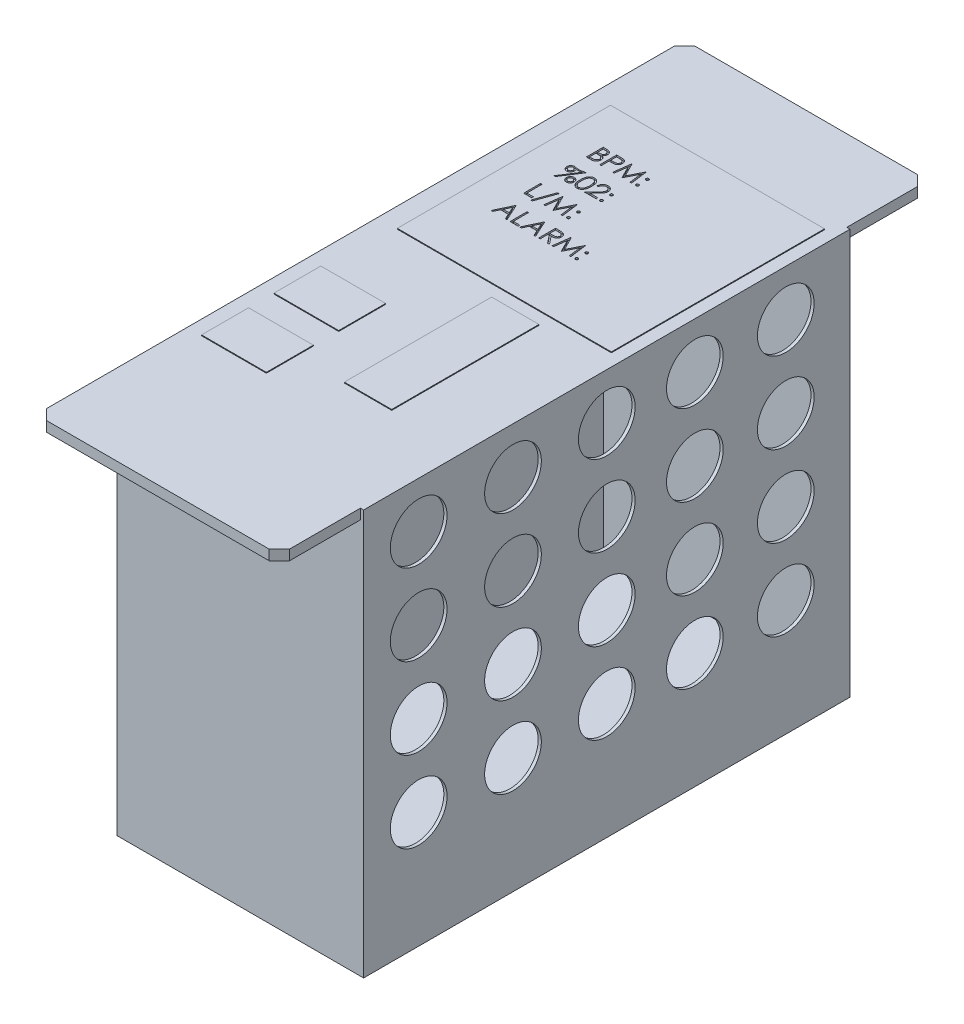
from build123d import *

# Parameters (mm, degrees)
BOSS_EXTRUDE1_DEPTH = 76.2
SHELL1_T            = -2.54
SKETCH2_W           = 152.4
SKETCH2_H           = 127
SKETCH2_R           = 8.89
BOSS_EXTRUDE2_DEPTH = 1
SKETCH3_W           = 67.063290056
SKETCH3_H           = 66.799924184
SKETCH3_W_2         = 20.30243091
SKETCH3_H_2         = 14.698436083
SKETCH3_W_3         = 14.845093403
SKETCH3_H_3         = 46.15113371
SKETCH3_H_4         = 14.721186254
BOSS_EXTRUDE3_DEPTH = 0.254
CHAMFER1_SIZE       = 3.175
CUT_EXTRUDE1_DEPTH  = 0.508


with BuildPart() as part:
    # Sketch1 → Boss-Extrude1 (new body)
    with BuildSketch(Plane(origin=(0, 0, 0), x_dir=(0, 0, -1), z_dir=(1, 0, 0))):
        Polygon((-76.2, 0), (76.2, 0), (76.2, 123.825), (101.6, 123.825), (101.6, 127), (-101.6, 127), (-101.6, 123.825), (-76.2, 123.825), align=None)
    extrude(amount=-BOSS_EXTRUDE1_DEPTH)

    # Shell1
    shell1_openings = [part.faces().sort_by_distance(p)[0] for p in [
        (0, 64.011673554, 0),
    ]]
    offset(amount=SHELL1_T, openings=shell1_openings, kind=Kind.INTERSECTION)

    # Sketch2 → Boss-Extrude2 (add)
    with BuildSketch(Plane(origin=(0, 0, 0), x_dir=(0, 0, -1), z_dir=(1, 0, 0))):
        with Locations((0, 63.5)):
            Rectangle(SKETCH2_W, SKETCH2_H)
        with Locations((-58.940716084, 112.504202573)):
            Circle(SKETCH2_R, mode=Mode.SUBTRACT)
        with Locations((-29.38634328, 112.504202573)):
            Circle(SKETCH2_R, mode=Mode.SUBTRACT)
        with Locations((0, 112.504202573)):
            Circle(SKETCH2_R, mode=Mode.SUBTRACT)
        with Locations((27.59532567, 112.504202573)):
            Circle(SKETCH2_R, mode=Mode.SUBTRACT)
        with Locations((56.090557901, 112.504202573)):
            Circle(SKETCH2_R, mode=Mode.SUBTRACT)
        with Locations((-58.940716084, 87.104202573)):
            Circle(SKETCH2_R, mode=Mode.SUBTRACT)
        with Locations((-29.38634328, 87.104202573)):
            Circle(SKETCH2_R, mode=Mode.SUBTRACT)
        with Locations((0, 87.104202573)):
            Circle(SKETCH2_R, mode=Mode.SUBTRACT)
        with Locations((27.59532567, 87.104202573)):
            Circle(SKETCH2_R, mode=Mode.SUBTRACT)
        with Locations((56.090557901, 87.104202573)):
            Circle(SKETCH2_R, mode=Mode.SUBTRACT)
        with Locations((-58.940716084, 61.704202573)):
            Circle(SKETCH2_R, mode=Mode.SUBTRACT)
        with Locations((-29.38634328, 61.704202573)):
            Circle(SKETCH2_R, mode=Mode.SUBTRACT)
        with Locations((0, 61.704202573)):
            Circle(SKETCH2_R, mode=Mode.SUBTRACT)
        with Locations((27.59532567, 61.704202573)):
            Circle(SKETCH2_R, mode=Mode.SUBTRACT)
        with Locations((56.090557901, 61.704202573)):
            Circle(SKETCH2_R, mode=Mode.SUBTRACT)
        with Locations((-58.940716084, 36.304202573)):
            Circle(SKETCH2_R, mode=Mode.SUBTRACT)
        with Locations((-29.38634328, 36.304202573)):
            Circle(SKETCH2_R, mode=Mode.SUBTRACT)
        with Locations((0, 36.304202573)):
            Circle(SKETCH2_R, mode=Mode.SUBTRACT)
        with Locations((27.59532567, 36.304202573)):
            Circle(SKETCH2_R, mode=Mode.SUBTRACT)
        with Locations((56.090557901, 36.304202573)):
            Circle(SKETCH2_R, mode=Mode.SUBTRACT)
    extrude(amount=BOSS_EXTRUDE2_DEPTH)

    # Sketch3 → Boss-Extrude3 (add)
    with BuildSketch(Plane(origin=(0, 127, 0), x_dir=(1, 0, 0), z_dir=(0, 1, 0))):
        with Locations((-36.369581302, 38.672746326)):
            Rectangle(SKETCH3_W, SKETCH3_H)
        with Locations((-61.498070309, -24.301810751)):
            Rectangle(SKETCH3_W_2, SKETCH3_H_2)
        with Locations((-29.053207457, -21.683721901)):
            Rectangle(SKETCH3_W_3, SKETCH3_H_3)
        with Locations((-61.498070309, -46.957283717)):
            Rectangle(SKETCH3_W_2, SKETCH3_H_4)
    extrude(amount=BOSS_EXTRUDE3_DEPTH)

    # Chamfer1
    chamfer1_edges = [part.edges().sort_by_distance(p)[0] for p in [
        (0, 125.4125, 101.6),
        (-76.2, 125.4125, 101.6),
        (-76.2, 125.4125, -101.6),
        (0, 125.4125, -101.6),
    ]]
    chamfer(chamfer1_edges, length=CHAMFER1_SIZE)

    # Sketch4 → Cut-Extrude1 (cut)
    # profile 1 of 23: a face of its own
    with BuildSketch(Plane(origin=(0, 127.254, 0), x_dir=(1, 0, 0), z_dir=(0, 1, 0))):
        with BuildLine():
            Line((-59.643825401, 59.529582894), (-58.611356784, 59.529582894))
            add(Edge.make_bspline(
                [(-58.611356784, 59.529582894), (-58.560816109, 59.529317176), (-58.462855702, 59.528802149), (-58.320404879, 59.520814558), (-58.186981082, 59.509923295), (-58.062545616, 59.492642083), (-57.947155983, 59.47179023), (-57.840464436, 59.446538675), (-57.742810247, 59.416260342), (-57.626223134, 59.368111798), (-57.493295468, 59.296563674), (-57.349364565, 59.190838344), (-57.226289108, 59.061521405), (-57.12017408, 58.915648819), (-57.035808102, 58.75518164), (-56.974773569, 58.583944533), (-56.936132496, 58.404146186), (-56.932158553, 58.280709476), (-56.930150187, 58.218326551)],
                knots=[0, 0, 0, 0, 1.001505555, 1.941167018, 2.826882275, 3.653841531, 4.429895133, 5.150066043, 5.825578002, 6.45369114, 7.647487171, 8.808567382, 9.977351308, 11.170798116, 12.373658725, 13.556498008, 14.765093433, 16, 16, 16, 16], degree=3))
            add(Edge.make_bspline(
                [(-56.930150187, 58.218326551), (-56.931803029, 58.159887568), (-56.93505102, 58.045049455), (-56.966109716, 57.877085742), (-57.014733583, 57.717199971), (-57.082323662, 57.56597565), (-57.170168347, 57.426829592), (-57.274275567, 57.298639321), (-57.39987978, 57.186832365), (-57.493985631, 57.124325834), (-57.54178714, 57.092575349)],
                knots=[0, 0, 0, 0, 1.044552857, 2.05264487, 3.044412934, 4.028983338, 5.005914585, 5.980388656, 6.974128949, 8, 8, 8, 8], degree=3))
            add(Edge.make_bspline(
                [(-57.54178714, 57.092575349), (-57.48167316, 57.069496124), (-57.366660225, 57.02533985), (-57.208384944, 56.947271946), (-57.072018929, 56.862360184), (-56.95651372, 56.769632268), (-56.857729408, 56.669682042), (-56.771470794, 56.561043953), (-56.697869193, 56.442300831), (-56.634803225, 56.314690724), (-56.585592606, 56.179516658), (-56.54873856, 56.038046556), (-56.527621107, 55.890787705), (-56.524615983, 55.790570524), (-56.523098905, 55.739977859)],
                knots=[0, 0, 0, 0, 1.27268992, 2.434971085, 3.483601985, 4.442670788, 5.356604649, 6.2567628, 7.179492994, 8.113709626, 9.066344395, 10.018646069, 10.999752585, 12, 12, 12, 12], degree=3))
            add(Edge.make_bspline(
                [(-56.523098905, 55.739977859), (-56.524575803, 55.688320803), (-56.527481642, 55.586684096), (-56.548920409, 55.437375738), (-56.585219892, 55.294689807), (-56.635220315, 55.1577034), (-56.700477624, 55.02668153), (-56.779894904, 54.901475762), (-56.874587863, 54.783344095), (-56.980516248, 54.670973856), (-57.100353063, 54.569936606), (-57.229644741, 54.479954525), (-57.370019534, 54.405952741), (-57.519171953, 54.343789232), (-57.678775145, 54.296304539), (-57.848112421, 54.2630841), (-58.027037734, 54.240700294), (-58.149819144, 54.238859996), (-58.212785737, 54.237916227)],
                knots=[0, 0, 0, 0, 0.978564426, 1.925352924, 2.850884081, 3.763762016, 4.682927383, 5.618979971, 6.567305752, 7.547517671, 8.540179244, 9.531824382, 10.526200242, 11.540722885, 12.589160233, 13.674978461, 14.80764778, 16, 16, 16, 16], degree=3))
            Line((-58.212785737, 54.237916227), (-59.643825401, 54.237916227))
            Line((-59.643825401, 54.237916227), (-59.643825401, 59.529582894))
        make_face()
        with BuildLine():
            Line((-59.168932238, 58.986847851), (-59.168932238, 57.290800843))
            Line((-59.168932238, 57.290800843), (-58.849863395, 57.290800843))
            add(Edge.make_bspline(
                [(-58.849863395, 57.290800843), (-58.803222954, 57.291405488), (-58.713104118, 57.292573787), (-58.582596656, 57.295920414), (-58.461455259, 57.305291265), (-58.349889035, 57.314659423), (-58.248073674, 57.32989124), (-58.15623474, 57.348022188), (-58.072930909, 57.367197532), (-57.976865167, 57.399808542), (-57.867897734, 57.448004551), (-57.751733397, 57.522801256), (-57.64932533, 57.611889266), (-57.56284863, 57.714685125), (-57.492074145, 57.827875668), (-57.442916504, 57.94965488), (-57.40958311, 58.076987699), (-57.406572104, 58.16440339), (-57.405043349, 58.208786286)],
                knots=[0, 0, 0, 0, 1.156816544, 2.235205308, 3.236616184, 4.169592532, 5.011045266, 5.787822928, 6.49130361, 7.128639758, 8.301311294, 9.436451833, 10.541879658, 11.654887649, 12.756523258, 13.837046038, 14.901820046, 16, 16, 16, 16], degree=3))
            add(Edge.make_bspline(
                [(-57.405043349, 58.208786286), (-57.405838884, 58.238156203), (-57.407399411, 58.295768501), (-57.42018, 58.379753834), (-57.441902404, 58.458741412), (-57.469803538, 58.533813698), (-57.508793579, 58.602623281), (-57.554700244, 58.667549303), (-57.610165514, 58.72638072), (-57.673298593, 58.781367938), (-57.745883059, 58.830118593), (-57.827875607, 58.872815938), (-57.920385548, 58.907197826), (-58.021853793, 58.937309152), (-58.133842223, 58.95845812), (-58.255058512, 58.976076932), (-58.386495527, 58.985046673), (-58.477429194, 58.986234067), (-58.524434375, 58.986847851)],
                knots=[0, 0, 0, 0, 0.91205012, 1.789085906, 2.630437955, 3.453916878, 4.269457761, 5.079663411, 5.91843418, 6.774407191, 7.675494373, 8.627863946, 9.638891023, 10.736472738, 11.911756761, 13.175263542, 14.539845004, 16, 16, 16, 16], degree=3))
            Line((-58.524434375, 58.986847851), (-59.168932238, 58.986847851))
        make_face(mode=Mode.SUBTRACT)
        with BuildLine():
            Line((-59.168932238, 56.7480658), (-59.168932238, 54.78065127))
            Line((-59.168932238, 54.78065127), (-58.492633494, 54.78065127))
            add(Edge.make_bspline(
                [(-58.492633494, 54.78065127), (-58.444223927, 54.78123146), (-58.35092087, 54.782349698), (-58.216208295, 54.786000275), (-58.091350508, 54.794304073), (-57.976917255, 54.807375774), (-57.87167288, 54.821555096), (-57.776879924, 54.840622152), (-57.691769977, 54.862467604), (-57.59308144, 54.896234745), (-57.481951136, 54.948692505), (-57.362191865, 55.027786633), (-57.25571413, 55.122013539), (-57.165294274, 55.231068611), (-57.091191303, 55.349649308), (-57.037283651, 55.475357158), (-57.00403557, 55.606115039), (-57.000010624, 55.695267093), (-56.997992067, 55.739977859)],
                knots=[0, 0, 0, 0, 1.160039823, 2.235823828, 3.228722157, 4.157150951, 4.99529583, 5.772374946, 6.472645482, 7.099169577, 8.269452708, 9.405989375, 10.527446681, 11.663510218, 12.788923519, 13.866172445, 14.929861265, 16, 16, 16, 16], degree=3))
            add(Edge.make_bspline(
                [(-56.997992067, 55.739977859), (-56.998409511, 55.767938029), (-56.999237664, 55.823407368), (-57.011726927, 55.904922952), (-57.029890754, 55.983883498), (-57.053372803, 56.060503415), (-57.087571283, 56.133397449), (-57.127495464, 56.204007271), (-57.174306155, 56.272426222), (-57.247246739, 56.3589257), (-57.353340097, 56.458585946), (-57.504087245, 56.556160503), (-57.675495362, 56.63485183), (-57.7998155, 56.668264134), (-57.864036071, 56.685524067)],
                knots=[0, 0, 0, 0, 0.723448775, 1.435228256, 2.130040452, 2.821711965, 3.505591119, 4.210454504, 4.921174351, 5.648778258, 7.137944449, 8.670945889, 10.280296675, 12, 12, 12, 12], degree=3))
            add(Edge.make_bspline(
                [(-57.864036071, 56.685524067), (-57.889782442, 56.690747824), (-57.945605885, 56.702074009), (-58.036634013, 56.714029703), (-58.140556101, 56.724681163), (-58.257612117, 56.732559937), (-58.387950163, 56.740703878), (-58.531848599, 56.743871048), (-58.688719777, 56.747649691), (-58.797565388, 56.747923549), (-58.854103512, 56.7480658)],
                knots=[0, 0, 0, 0, 0.634451884, 1.375622551, 2.216452059, 3.157844607, 4.20941857, 5.370758133, 6.634282058, 8, 8, 8, 8], degree=3))
            Line((-58.854103512, 56.7480658), (-59.168932238, 56.7480658))
        make_face(mode=Mode.SUBTRACT)
    # profile 2 of 23: a face of its own
    with BuildSketch(Plane(origin=(0, 127.254, 0), x_dir=(1, 0, 0), z_dir=(0, 1, 0))):
        with BuildLine():
            Line((-55.43762882, 59.529582894), (-54.399860056, 59.529582894))
            add(Edge.make_bspline(
                [(-54.399860056, 59.529582894), (-54.328481662, 59.529504432), (-54.19171749, 59.529354095), (-53.995600679, 59.524796086), (-53.817483585, 59.518708111), (-53.657750271, 59.51026882), (-53.515909266, 59.500295404), (-53.392602396, 59.486307202), (-53.286860448, 59.471701755), (-53.223501887, 59.456852724), (-53.194606651, 59.45008069)],
                knots=[0, 0, 0, 0, 1.415646017, 2.712440637, 3.8905458, 4.950247383, 5.884950622, 6.709939814, 7.411656543, 8, 8, 8, 8], degree=3))
            add(Edge.make_bspline(
                [(-53.194606651, 59.45008069), (-53.158028332, 59.440068933), (-53.085733616, 59.420281333), (-52.981561801, 59.380648679), (-52.88245063, 59.333655406), (-52.788060059, 59.280097782), (-52.699550005, 59.217677941), (-52.61559992, 59.148926162), (-52.536950664, 59.0722551), (-52.464044512, 58.988524696), (-52.397090115, 58.899140569), (-52.339441666, 58.802768388), (-52.29117074, 58.701030346), (-52.249769841, 58.593997209), (-52.219972535, 58.480770172), (-52.197525437, 58.362135976), (-52.183277809, 58.238107337), (-52.181913222, 58.153350156), (-52.181218563, 58.110203554)],
                knots=[0, 0, 0, 0, 0.999701418, 1.975846123, 2.934577507, 3.890451536, 4.834027766, 5.787354733, 6.749476667, 7.726910423, 8.712836071, 9.690891519, 10.682875813, 11.679750201, 12.712814741, 13.765529915, 14.8625177, 16, 16, 16, 16], degree=3))
            add(Edge.make_bspline(
                [(-52.181218563, 58.110203554), (-52.181855717, 58.066694296), (-52.183102352, 57.981565495), (-52.198064593, 57.857025684), (-52.218218573, 57.738010975), (-52.249208164, 57.624785258), (-52.289796265, 57.518020939), (-52.33740925, 57.416086457), (-52.39483673, 57.320716), (-52.460823556, 57.231563335), (-52.534228943, 57.148544777), (-52.614742314, 57.072261933), (-52.702038625, 57.003161326), (-52.795840444, 56.941088044), (-52.897062239, 56.887481526), (-53.004168829, 56.839467506), (-53.11809118, 56.799143402), (-53.196925695, 56.777931286), (-53.237007826, 56.767146329)],
                knots=[0, 0, 0, 0, 1.121902311, 2.195077645, 3.232258892, 4.234102512, 5.217864754, 6.176164875, 7.132989551, 8.084763148, 9.034132444, 9.988522005, 10.94243251, 11.903244335, 12.886203696, 13.894208494, 14.929344452, 16, 16, 16, 16], degree=3))
            add(Edge.make_bspline(
                [(-53.237007826, 56.767146329), (-53.270159867, 56.760096346), (-53.342814491, 56.744645897), (-53.46247075, 56.727397397), (-53.601785798, 56.712675072), (-53.760569483, 56.701636447), (-53.938679279, 56.692186486), (-54.136211538, 56.684675201), (-54.353554011, 56.680547922), (-54.505154583, 56.680335057), (-54.584305168, 56.68022392)],
                knots=[0, 0, 0, 0, 0.601384939, 1.31797006, 2.144135048, 3.087295005, 4.142315834, 5.309527816, 6.595305764, 8, 8, 8, 8], degree=3))
            Line((-54.584305168, 56.68022392), (-54.962735657, 56.68022392))
            Line((-54.962735657, 56.68022392), (-54.962735657, 54.237916227))
            Line((-54.962735657, 54.237916227), (-55.43762882, 54.237916227))
            Line((-55.43762882, 54.237916227), (-55.43762882, 59.529582894))
        make_face()
        with BuildLine():
            Line((-54.962735657, 58.986847851), (-54.962735657, 57.222958962))
            Line((-54.962735657, 57.222958962), (-54.036269979, 57.211298639))
            add(Edge.make_bspline(
                [(-54.036269979, 57.211298639), (-53.9910339, 57.21127526), (-53.903706584, 57.211230126), (-53.777558961, 57.217255404), (-53.660523491, 57.224210972), (-53.552959668, 57.234395046), (-53.454819005, 57.248790281), (-53.365937861, 57.263322313), (-53.287005421, 57.284345897), (-53.194629247, 57.312653395), (-53.09169371, 57.360932468), (-52.97971063, 57.431009088), (-52.884807482, 57.520333492), (-52.80268339, 57.620766046), (-52.737511408, 57.732494492), (-52.689801753, 57.852039194), (-52.661769289, 57.978174157), (-52.658010401, 58.064485986), (-52.656111726, 58.108083495)],
                knots=[0, 0, 0, 0, 1.160613943, 2.240541288, 3.23993089, 4.169200891, 5.011653406, 5.7853311, 6.478053781, 7.106038997, 8.262395093, 9.384106736, 10.481365981, 11.59014053, 12.70357646, 13.786202915, 14.881775077, 16, 16, 16, 16], degree=3))
            add(Edge.make_bspline(
                [(-52.656111726, 58.108083495), (-52.658020727, 58.150626247), (-52.661815585, 58.235195974), (-52.690021473, 58.359140053), (-52.73741865, 58.477424987), (-52.803120882, 58.587753342), (-52.882860448, 58.68782451), (-52.975539217, 58.77475469), (-53.080939029, 58.844637502), (-53.178983378, 58.889742583), (-53.266070885, 58.917282345), (-53.341714444, 58.93655133), (-53.427122963, 58.951935877), (-53.522324249, 58.964393221), (-53.626580415, 58.975057382), (-53.740787153, 58.982293324), (-53.864511828, 58.986528859), (-53.950404, 58.986738946), (-53.994928833, 58.986847851)],
                knots=[0, 0, 0, 0, 1.120700087, 2.227813068, 3.331159281, 4.466773991, 5.599788987, 6.693661531, 7.80175334, 8.91857717, 9.525282508, 10.207424825, 10.974604443, 11.810962634, 12.737642355, 13.736264703, 14.826523623, 16, 16, 16, 16], degree=3))
            Line((-53.994928833, 58.986847851), (-54.962735657, 58.986847851))
        make_face(mode=Mode.SUBTRACT)
    # profile 3 of 23: a face of its own
    with BuildSketch(Plane(origin=(0, 127.254, 0), x_dir=(1, 0, 0), z_dir=(0, 1, 0))):
        Polygon((-51.367115999, 54.237916227), (-50.668556637, 59.529582894), (-50.600714757, 59.529582894), (-48.415994204, 55.187702552), (-46.236573798, 59.529582894), (-46.167671888, 59.529582894), (-45.464872409, 54.237916227), (-45.94188563, 54.237916227), (-46.448579674, 58.045541762), (-48.358752618, 54.237916227), (-48.465815585, 54.237916227), (-50.383408734, 58.054021997), (-50.889042749, 54.237916227), align=None)
    # profile 4 of 23: a face of its own
    with BuildSketch(Plane(origin=(0, 127.254, 0), x_dir=(1, 0, 0), z_dir=(0, 1, 0))):
        with BuildLine():
            add(Edge.make_bspline(
                [(-44.006271982, 58.172745287), (-43.976804637, 58.170994249), (-43.919037353, 58.167561545), (-43.835521052, 58.144011097), (-43.759933888, 58.102193837), (-43.692605375, 58.046460827), (-43.637108678, 57.978885241), (-43.593801146, 57.90390095), (-43.570455847, 57.819685447), (-43.567048147, 57.761583439), (-43.56529976, 57.731773065)],
                knots=[0, 0, 0, 0, 1.020151414, 1.999887582, 2.974338812, 3.990962822, 5.007586832, 5.987933904, 6.967670073, 8, 8, 8, 8], degree=3))
            add(Edge.make_bspline(
                [(-43.56529976, 57.731773065), (-43.567048147, 57.701962691), (-43.570455847, 57.643860683), (-43.593801146, 57.55964518), (-43.637108678, 57.484660889), (-43.692605375, 57.417085303), (-43.759933888, 57.361352293), (-43.835521052, 57.319535032), (-43.919037353, 57.295984585), (-43.976804637, 57.29255188), (-44.006271982, 57.290800843)],
                knots=[0, 0, 0, 0, 1.032329927, 2.012066096, 2.992413168, 4.009037178, 5.025661188, 6.000112418, 6.979848586, 8, 8, 8, 8], degree=3))
            add(Edge.make_bspline(
                [(-44.006271982, 57.290800843), (-44.035759722, 57.292494018), (-44.093227129, 57.295793775), (-44.176441672, 57.320045351), (-44.252484744, 57.360964741), (-44.319801239, 57.417188401), (-44.375749872, 57.484311802), (-44.417140097, 57.560161704), (-44.442503298, 57.643617497), (-44.445638411, 57.701913884), (-44.447244204, 57.731773065)],
                knots=[0, 0, 0, 0, 1.020591893, 1.988988293, 2.974634352, 3.991697318, 5.008760285, 5.983632262, 6.967224335, 8, 8, 8, 8], degree=3))
            add(Edge.make_bspline(
                [(-44.447244204, 57.731773065), (-44.445579867, 57.760919282), (-44.442292153, 57.818494416), (-44.41712821, 57.901246098), (-44.375802348, 57.977182113), (-44.319446968, 58.044146674), (-44.252891499, 58.101723484), (-44.176200605, 58.142075115), (-44.093441678, 58.168103861), (-44.035798392, 58.171173128), (-44.006271982, 58.172745287)],
                knots=[0, 0, 0, 0, 1.010056097, 1.99525427, 2.971718109, 3.990441831, 5.01702829, 6.004283803, 6.977741589, 8, 8, 8, 8], degree=3))
        make_face()
    # profile 5 of 23: a face of its own
    with BuildSketch(Plane(origin=(0, 127.254, 0), x_dir=(1, 0, 0), z_dir=(0, 1, 0))):
        with BuildLine():
            add(Edge.make_bspline(
                [(-44.006271982, 55.052018791), (-43.976804637, 55.050267754), (-43.919037353, 55.046835049), (-43.835521052, 55.023284602), (-43.759933888, 54.981467341), (-43.692605375, 54.925734331), (-43.637108678, 54.858158745), (-43.593801146, 54.783174455), (-43.570455847, 54.698958952), (-43.567048147, 54.640856943), (-43.56529976, 54.611046569)],
                knots=[0, 0, 0, 0, 1.020151414, 1.999887582, 2.974338812, 3.990962822, 5.007586832, 5.987933904, 6.967670073, 8, 8, 8, 8], degree=3))
            add(Edge.make_bspline(
                [(-43.56529976, 54.611046569), (-43.567107394, 54.581952487), (-43.570672023, 54.524579385), (-43.593747633, 54.440999079), (-43.637438732, 54.365967925), (-43.692222591, 54.297475407), (-43.759950532, 54.241624329), (-43.835699752, 54.200162843), (-43.918841297, 54.174926159), (-43.976771929, 54.171711401), (-44.006271982, 54.170074347)],
                knots=[0, 0, 0, 0, 1.009421747, 1.99056486, 2.972319754, 3.999869655, 5.017953583, 5.993804169, 6.978383603, 8, 8, 8, 8], degree=3))
            add(Edge.make_bspline(
                [(-44.006271982, 54.170074347), (-44.035793292, 54.171652167), (-44.093426621, 54.174732484), (-44.176257827, 54.200681012), (-44.252468363, 54.241235529), (-44.320183117, 54.297579547), (-44.375425807, 54.365615478), (-44.417192754, 54.441515813), (-44.44227548, 54.52434013), (-44.445574263, 54.581905363), (-44.447244204, 54.611046569)],
                knots=[0, 0, 0, 0, 1.022052826, 1.995314843, 2.982371812, 4.00089066, 5.028879526, 6.005146991, 6.990147033, 8, 8, 8, 8], degree=3))
            add(Edge.make_bspline(
                [(-44.447244204, 54.611046569), (-44.445638411, 54.64090575), (-44.442503298, 54.699202137), (-44.417140097, 54.78265793), (-44.375749872, 54.858507833), (-44.319801239, 54.925631234), (-44.252484744, 54.981854894), (-44.176441672, 55.022774283), (-44.093227129, 55.047025859), (-44.035759722, 55.050325616), (-44.006271982, 55.052018791)],
                knots=[0, 0, 0, 0, 1.032775665, 2.016367738, 2.991239715, 4.008302682, 5.025365648, 6.011011707, 6.979408107, 8, 8, 8, 8], degree=3))
        make_face()
    # profile 6 of 23: a face of its own
    with BuildSketch(Plane(origin=(0, 127.254, 0), x_dir=(1, 0, 0), z_dir=(0, 1, 0))):
        with BuildLine():
            Line((-55.369786939, 49.913664091), (-59.168932238, 44.079262381))
            Line((-59.168932238, 44.079262381), (-59.640645313, 44.079262381))
            Line((-59.640645313, 44.079262381), (-56.181769445, 49.391069606))
            add(Edge.make_bspline(
                [(-56.181769445, 49.391069606), (-56.235034751, 49.378629899), (-56.344321096, 49.353106904), (-56.513502176, 49.322244326), (-56.691094272, 49.293715015), (-56.877286245, 49.273623231), (-57.072003453, 49.256425695), (-57.275227036, 49.243717931), (-57.487313729, 49.236185191), (-57.631530026, 49.235562599), (-57.705031664, 49.235245287)],
                knots=[0, 0, 0, 0, 0.855189208, 1.754622445, 2.688442312, 3.667131484, 4.682095654, 5.744999071, 6.850710588, 8, 8, 8, 8], degree=3))
            Line((-57.705031664, 49.235245287), (-57.897957011, 49.238425375))
            add(Edge.make_bspline(
                [(-57.897957011, 49.238425375), (-57.864230443, 49.187733538), (-57.798376964, 49.088754186), (-57.727730571, 48.927551183), (-57.684370263, 48.76122034), (-57.679062336, 48.648242969), (-57.676410871, 48.591807453)],
                knots=[0, 0, 0, 0, 1.050167499, 2.050525365, 3.026180155, 4, 4, 4, 4], degree=3))
            add(Edge.make_bspline(
                [(-57.676410871, 48.591807453), (-57.677438283, 48.551831921), (-57.679483102, 48.472270196), (-57.695599657, 48.35471863), (-57.722804984, 48.24041352), (-57.758021263, 48.12875786), (-57.806523466, 48.021144589), (-57.865589594, 47.917117898), (-57.932885245, 47.814646752), (-58.012333975, 47.718326093), (-58.098795068, 47.628310772), (-58.194605451, 47.550455393), (-58.295794309, 47.482861667), (-58.405821252, 47.430095706), (-58.521264399, 47.387042028), (-58.644469015, 47.357816119), (-58.774041837, 47.339356451), (-58.862872688, 47.336916632), (-58.908165011, 47.335672638)],
                knots=[0, 0, 0, 0, 0.977982368, 1.946439705, 2.896504964, 3.850770686, 4.806797443, 5.778452989, 6.776037061, 7.802321955, 8.829516982, 9.824775243, 10.817589304, 11.799766913, 12.803663334, 13.827030361, 14.892064627, 16, 16, 16, 16], degree=3))
            add(Edge.make_bspline(
                [(-58.908165011, 47.335672638), (-58.949918638, 47.336587328), (-59.032369357, 47.338393562), (-59.153494224, 47.35583581), (-59.269756653, 47.384249154), (-59.380372678, 47.425033805), (-59.486205683, 47.475903605), (-59.586491456, 47.539267291), (-59.681798344, 47.613669118), (-59.771504252, 47.697888446), (-59.852512251, 47.790759296), (-59.923936226, 47.889177715), (-59.983483019, 47.993291533), (-60.03395358, 48.101411721), (-60.072163291, 48.215246508), (-60.098035896, 48.334042385), (-60.116137066, 48.456984922), (-60.117850825, 48.540858831), (-60.118718563, 48.583327218)],
                knots=[0, 0, 0, 0, 1.033901007, 2.041640166, 3.024666075, 3.993953674, 4.957094558, 5.928632781, 6.926744369, 7.948567375, 8.972188708, 9.975583979, 10.956073043, 11.939215879, 12.927489814, 13.923526243, 14.948606393, 16, 16, 16, 16], degree=3))
            add(Edge.make_bspline(
                [(-60.118718563, 48.583327218), (-60.117146288, 48.6400203), (-60.114046171, 48.751804296), (-60.081652079, 48.914777883), (-60.032357851, 49.070175016), (-59.961219678, 49.215665607), (-59.874328863, 49.352094302), (-59.766272499, 49.473225688), (-59.644102969, 49.582798093), (-59.505457612, 49.674359897), (-59.35913931, 49.750868717), (-59.207130949, 49.804998068), (-59.053561846, 49.83989995), (-58.950039968, 49.843856933), (-58.898624746, 49.84582221)],
                knots=[0, 0, 0, 0, 1.046745478, 2.063909522, 3.059537565, 4.052827418, 5.049290729, 6.039806234, 7.043861919, 8.074671392, 9.102973742, 10.088501715, 11.050634409, 12, 12, 12, 12], degree=3))
            add(Edge.make_bspline(
                [(-58.898624746, 49.84582221), (-58.873139646, 49.844484389), (-58.814794505, 49.841421603), (-58.716915108, 49.824770847), (-58.597569641, 49.800928491), (-58.511603211, 49.778473871), (-58.46507273, 49.766320007)],
                knots=[0, 0, 0, 0, 0.692955639, 1.586440504, 2.693628627, 4, 4, 4, 4], degree=3))
            add(Edge.make_bspline(
                [(-58.46507273, 49.766320007), (-58.386506446, 49.747190317), (-58.227253296, 49.708414608), (-57.980236733, 49.670155168), (-57.7238898, 49.646157639), (-57.54961632, 49.643595888), (-57.461224907, 49.642296569)],
                knots=[0, 0, 0, 0, 0.956358772, 1.938530612, 2.954423861, 4, 4, 4, 4], degree=3))
            add(Edge.make_bspline(
                [(-57.461224907, 49.642296569), (-57.395837284, 49.642759694), (-57.266739543, 49.643674061), (-57.075901529, 49.655364547), (-56.890491095, 49.67026848), (-56.705105307, 49.694507138), (-56.509520771, 49.729561743), (-56.292646722, 49.778242004), (-56.049385133, 49.839486906), (-55.879172992, 49.888080312), (-55.789558574, 49.913664091)],
                knots=[0, 0, 0, 0, 0.92279556, 1.821917, 2.697917306, 3.547904463, 4.459717683, 5.501612841, 6.684632538, 8, 8, 8, 8], degree=3))
            Line((-55.789558574, 49.913664091), (-55.369786939, 49.913664091))
        make_face()
        with BuildLine():
            add(Edge.make_bspline(
                [(-58.899684776, 49.370929048), (-58.924823693, 49.370512659), (-58.974679837, 49.369686865), (-59.047743287, 49.357194375), (-59.118256927, 49.339041104), (-59.186738135, 49.315257818), (-59.251162814, 49.281598794), (-59.31335719, 49.242470816), (-59.371888644, 49.195028574), (-59.445631089, 49.124164443), (-59.52491882, 49.024384936), (-59.594686548, 48.890022404), (-59.636121072, 48.742990795), (-59.641219833, 48.640832351), (-59.643825401, 48.588627365)],
                knots=[0, 0, 0, 0, 0.7534051, 1.494172318, 2.21673533, 2.937741092, 3.663176203, 4.392551616, 5.139288289, 5.91908518, 7.458951164, 8.938359792, 10.435441294, 12, 12, 12, 12], degree=3))
            add(Edge.make_bspline(
                [(-59.643825401, 48.588627365), (-59.641280981, 48.536398794), (-59.63631848, 48.434534965), (-59.594143173, 48.287845631), (-59.525595763, 48.153081898), (-59.429839484, 48.034927621), (-59.317343318, 47.934552706), (-59.18764004, 47.863840033), (-59.047679835, 47.817425264), (-58.949523363, 47.812875782), (-58.899684776, 47.8105658)],
                knots=[0, 0, 0, 0, 1.04580407, 2.039680683, 3.034870211, 4.058616052, 5.073270728, 6.037602874, 7.003600085, 8, 8, 8, 8], degree=3))
            add(Edge.make_bspline(
                [(-58.899684776, 47.8105658), (-58.849490478, 47.812846642), (-58.750975645, 47.817323181), (-58.610643201, 47.863802576), (-58.48082956, 47.934825074), (-58.367525791, 48.034886779), (-58.270419401, 48.152727952), (-58.202403621, 48.288067675), (-58.158457607, 48.434329778), (-58.153727162, 48.536362169), (-58.151304033, 48.588627365)],
                knots=[0, 0, 0, 0, 1.00110557, 1.96483968, 2.926912627, 3.944533771, 4.970300809, 5.963158846, 6.956645999, 8, 8, 8, 8], degree=3))
            add(Edge.make_bspline(
                [(-58.151304033, 48.588627365), (-58.153786932, 48.640870827), (-58.158650228, 48.743200993), (-58.201880278, 48.889776967), (-58.271006634, 49.024834304), (-58.351677965, 49.123804735), (-58.425388674, 49.1954255), (-58.484873121, 49.242129663), (-58.547105899, 49.281649572), (-58.611582209, 49.315244383), (-58.680049741, 49.33904453), (-58.750566861, 49.357194075), (-58.823979263, 49.369744138), (-58.874191216, 49.370530034), (-58.899684776, 49.370929048)],
                knots=[0, 0, 0, 0, 1.560867277, 3.05729751, 4.533215612, 6.076024656, 6.85398169, 7.607244631, 8.334899151, 9.058622666, 9.777927282, 10.498785474, 11.237804921, 12, 12, 12, 12], degree=3))
        make_face(mode=Mode.SUBTRACT)
    # profile 7 of 23: a face of its own
    with BuildSketch(Plane(origin=(0, 127.254, 0), x_dir=(1, 0, 0), z_dir=(0, 1, 0))):
        with BuildLine():
            add(Edge.make_bspline(
                [(-55.980363862, 46.792937595), (-55.93894147, 46.792172461), (-55.857449275, 46.790667178), (-55.737640147, 46.771130035), (-55.621969379, 46.743345332), (-55.511068857, 46.702703077), (-55.405256478, 46.650281611), (-55.304494671, 46.586081057), (-55.207009618, 46.511575975), (-55.116319884, 46.425428724), (-55.033188238, 46.331661245), (-54.959023504, 46.232984268), (-54.897930811, 46.128355597), (-54.845708738, 46.020071975), (-54.8086282, 45.905590601), (-54.779148486, 45.787491039), (-54.76199123, 45.664157335), (-54.760144887, 45.580315139), (-54.759210016, 45.537862809)],
                knots=[0, 0, 0, 0, 1.020349682, 2.007381285, 2.985799444, 3.950543688, 4.913003205, 5.892003121, 6.892328163, 7.933994568, 8.970876379, 9.979853573, 10.972063258, 11.954276001, 12.937917586, 13.933259326, 14.953534604, 16, 16, 16, 16], degree=3))
            add(Edge.make_bspline(
                [(-54.759210016, 45.537862809), (-54.760144809, 45.495410424), (-54.761990998, 45.411568121), (-54.779149379, 45.288235197), (-54.808624954, 45.170132767), (-54.845720699, 45.055661929), (-54.897886031, 44.947338994), (-54.959337807, 44.842613785), (-55.032885192, 44.743161335), (-55.115941919, 44.649149919), (-55.207779492, 44.564377664), (-55.303758335, 44.488246267), (-55.405650458, 44.42570054), (-55.511008596, 44.372931731), (-55.621985785, 44.332405009), (-55.737635708, 44.304588892), (-55.857450433, 44.285060184), (-55.93894186, 44.283553744), (-55.980363862, 44.282788022)],
                knots=[0, 0, 0, 0, 1.046349956, 2.066512682, 3.061744622, 4.045277697, 5.027382088, 6.019482318, 7.035358079, 8.072125507, 9.107720949, 10.113271166, 11.08753877, 12.049892114, 13.014529933, 13.992840158, 14.979762877, 16, 16, 16, 16], degree=3))
            add(Edge.make_bspline(
                [(-55.980363862, 44.282788022), (-56.021787588, 44.283549367), (-56.103282407, 44.285047195), (-56.223072403, 44.304638694), (-56.33849135, 44.332143964), (-56.44913341, 44.373466523), (-56.554890198, 44.425356216), (-56.656945633, 44.488295993), (-56.752956994, 44.564362795), (-56.844775334, 44.649157506), (-56.927875209, 44.743146231), (-57.001273447, 44.842665022), (-57.063186889, 44.947025757), (-57.113379474, 45.056173009), (-57.152508922, 45.169863231), (-57.181459076, 45.28827885), (-57.198767754, 45.411556766), (-57.200593345, 45.495406607), (-57.201517708, 45.537862809)],
                knots=[0, 0, 0, 0, 1.02031541, 2.007313861, 2.985699156, 3.942232143, 4.912475611, 5.886817974, 6.892445352, 7.92812026, 8.964967244, 9.980920958, 10.973097316, 11.951598987, 12.938020436, 13.933328745, 14.953569753, 16, 16, 16, 16], degree=3))
            add(Edge.make_bspline(
                [(-57.201517708, 45.537862809), (-57.200593267, 45.580318956), (-57.198767522, 45.664168691), (-57.181459967, 45.787447386), (-57.152505679, 45.905860138), (-57.113391428, 46.019560897), (-57.063142397, 46.128669008), (-57.001588666, 46.232933439), (-56.927572051, 46.331676287), (-56.844397326, 46.425421129), (-56.753726825, 46.511590806), (-56.65620961, 46.586031864), (-56.555286775, 46.650630144), (-56.449073557, 46.702168927), (-56.338507686, 46.743606262), (-56.223067967, 46.77108024), (-56.103283564, 46.790680165), (-56.021787978, 46.792176838), (-55.980363862, 46.792937595)],
                knots=[0, 0, 0, 0, 1.046545705, 2.066899282, 3.062317408, 4.048847694, 5.027457327, 6.019743158, 7.028797784, 8.065759168, 9.107505514, 10.107907324, 11.086982371, 12.05733289, 13.013971417, 13.992464662, 14.979572013, 16, 16, 16, 16], degree=3))
        make_face()
        with BuildLine():
            add(Edge.make_bspline(
                [(-55.982483921, 46.318044432), (-56.032308665, 46.315709785), (-56.130437873, 46.311111726), (-56.27076322, 46.264998167), (-56.399830838, 46.192791135), (-56.512694268, 46.092712931), (-56.608360598, 45.974439508), (-56.677178225, 45.839426), (-56.71897863, 45.692262415), (-56.724038733, 45.590080029), (-56.726624546, 45.537862809)],
                knots=[0, 0, 0, 0, 0.995121133, 1.959878581, 2.926425669, 3.939778136, 4.962210099, 5.956122399, 6.955538117, 8, 8, 8, 8], degree=3))
            add(Edge.make_bspline(
                [(-56.726624546, 45.537862809), (-56.724038733, 45.485645588), (-56.71897863, 45.383463202), (-56.677178225, 45.236299617), (-56.608360598, 45.101286109), (-56.512694268, 44.983012687), (-56.399830838, 44.882934482), (-56.27076322, 44.81072745), (-56.130437873, 44.764613891), (-56.032308665, 44.760015832), (-55.982483921, 44.757681185)],
                knots=[0, 0, 0, 0, 1.044461883, 2.043877601, 3.037789901, 4.060221864, 5.073574331, 6.040121419, 7.004878867, 8, 8, 8, 8], degree=3))
            add(Edge.make_bspline(
                [(-55.982483921, 44.757681185), (-55.932303601, 44.759986929), (-55.8338162, 44.764512343), (-55.693118413, 44.810690209), (-55.56394175, 44.883209192), (-55.450268728, 44.982971163), (-55.353253808, 45.10093267), (-55.28496559, 45.236520041), (-55.241397624, 45.383259945), (-55.236568587, 45.485609465), (-55.234103179, 45.537862809)],
                knots=[0, 0, 0, 0, 0.999825402, 1.962327134, 2.926614321, 3.942934178, 4.967389512, 5.958977928, 6.957980192, 8, 8, 8, 8], degree=3))
            add(Edge.make_bspline(
                [(-55.234103179, 45.537862809), (-55.236568587, 45.590116152), (-55.241397624, 45.692465672), (-55.28496559, 45.839205576), (-55.353253808, 45.974792947), (-55.450268728, 46.092754454), (-55.56394175, 46.192516425), (-55.693118413, 46.265035408), (-55.8338162, 46.311213275), (-55.932303601, 46.315738689), (-55.982483921, 46.318044432)],
                knots=[0, 0, 0, 0, 1.042019808, 2.041022072, 3.032610488, 4.057065822, 5.073385679, 6.037672866, 7.000174598, 8, 8, 8, 8], degree=3))
        make_face(mode=Mode.SUBTRACT)
    # profile 8 of 23: a face of its own
    with BuildSketch(Plane(origin=(0, 127.254, 0), x_dir=(1, 0, 0), z_dir=(0, 1, 0))):
        with BuildLine():
            add(Edge.make_bspline(
                [(-54.420000614, 47.062185057), (-54.419504682, 47.146998965), (-54.418541327, 47.311751203), (-54.407824309, 47.55181846), (-54.390021113, 47.77703223), (-54.365622942, 47.987403294), (-54.335932187, 48.182985962), (-54.296296868, 48.363257559), (-54.251222749, 48.52905244), (-54.198982742, 48.680911252), (-54.140036918, 48.820879922), (-54.075880357, 48.951546595), (-54.003966918, 49.072713564), (-53.928406585, 49.186314747), (-53.846140715, 49.290490572), (-53.759510401, 49.386712216), (-53.665134469, 49.472755851), (-53.566221111, 49.551142522), (-53.46187479, 49.619857795), (-53.355069807, 49.680383483), (-53.245071016, 49.732090425), (-53.131578096, 49.772746203), (-53.015611134, 49.806326888), (-52.896764735, 49.829291131), (-52.774842673, 49.843740266), (-52.692547528, 49.845121645), (-52.650811579, 49.84582221)],
                knots=[0, 0, 0, 0, 1.646270934, 3.197905019, 4.663502075, 6.030701355, 7.308322542, 8.50163776, 9.611534131, 10.641858119, 11.616356847, 12.558055219, 13.465016945, 14.349605745, 15.204443733, 16.039544428, 16.859896111, 17.680448484, 18.487036065, 19.28249412, 20.06191084, 20.843045899, 21.620316918, 22.403196591, 23.190181807, 24, 24, 24, 24], degree=3))
            add(Edge.make_bspline(
                [(-52.650811579, 49.84582221), (-52.608726986, 49.84508468), (-52.525033973, 49.843617965), (-52.40129912, 49.829521052), (-52.280422815, 49.806130187), (-52.162920391, 49.772987761), (-52.047826662, 49.731870488), (-51.936041855, 49.680334013), (-51.826871624, 49.620343345), (-51.722050832, 49.549852483), (-51.620428735, 49.471260232), (-51.524501458, 49.382416673), (-51.434260269, 49.284218883), (-51.348572605, 49.177717494), (-51.269869499, 49.060869806), (-51.194919191, 48.935708116), (-51.127832899, 48.800043595), (-51.06322214, 48.656139792), (-51.007452529, 48.500014974), (-50.957157134, 48.332549206), (-50.916518694, 48.151764423), (-50.882668246, 47.958609147), (-50.856444415, 47.752374024), (-50.837345064, 47.533501142), (-50.827255995, 47.301846504), (-50.825355982, 47.143462613), (-50.824380956, 47.062185057)],
                knots=[0, 0, 0, 0, 0.810914788, 1.612654377, 2.396697861, 3.181598691, 3.963628158, 4.749916497, 5.551656086, 6.361998678, 7.18212741, 8.025565596, 8.878627764, 9.750805457, 10.657531673, 11.591944965, 12.560506719, 13.57287815, 14.630710178, 15.753379473, 16.941251878, 18.199788006, 19.531962791, 20.947069417, 22.433333509, 24, 24, 24, 24], degree=3))
            add(Edge.make_bspline(
                [(-50.824380956, 47.062185057), (-50.82536609, 46.981262006), (-50.827285583, 46.823586741), (-50.837231961, 46.592974433), (-50.856824177, 46.375263106), (-50.881332136, 46.169930621), (-50.915275854, 45.977831602), (-50.957012236, 45.798301305), (-51.003352605, 45.630564434), (-51.06055521, 45.475995136), (-51.123164261, 45.332437174), (-51.191283426, 45.19838089), (-51.264262806, 45.072641376), (-51.34377198, 44.956225092), (-51.428519402, 44.848307361), (-51.520318916, 44.750793098), (-51.616582777, 44.661332677), (-51.71850393, 44.581728431), (-51.824959489, 44.512052595), (-51.93375476, 44.449741179), (-52.046820114, 44.399496509), (-52.161593269, 44.356354244), (-52.279715917, 44.323394037), (-52.401040818, 44.300603803), (-52.524950841, 44.284620175), (-52.608712731, 44.283400855), (-52.650811579, 44.282788022)],
                knots=[0, 0, 0, 0, 1.561518951, 3.042555995, 4.452378317, 5.7783523, 7.031515105, 8.214008947, 9.334062868, 10.386615937, 11.391082383, 12.354592575, 13.286541444, 14.194233754, 15.072674879, 15.931287219, 16.775624067, 17.606195743, 18.42308326, 19.229000347, 20.022332153, 20.807536673, 21.593273796, 22.3848459, 23.188221202, 24, 24, 24, 24], degree=3))
            add(Edge.make_bspline(
                [(-52.650811579, 44.282788022), (-52.69254637, 44.283493107), (-52.774839232, 44.284883397), (-52.896778019, 44.299267253), (-53.015133618, 44.322392597), (-53.130490067, 44.354772463), (-53.243439203, 44.394406799), (-53.352441922, 44.446043916), (-53.458710206, 44.505513282), (-53.561960535, 44.573239693), (-53.66025273, 44.65083319), (-53.754139907, 44.736655388), (-53.841263448, 44.832847927), (-53.922353093, 44.93789193), (-53.999421059, 45.050820999), (-54.070313326, 45.173176991), (-54.135885927, 45.304474747), (-54.195823109, 45.445562541), (-54.248964541, 45.598499158), (-54.295905719, 45.765034226), (-54.33296879, 45.946637628), (-54.36469302, 46.14185079), (-54.390281076, 46.351512566), (-54.407750115, 46.575736778), (-54.418547103, 46.814383701), (-54.419507269, 46.978077288), (-54.420000614, 47.062185057)],
                knots=[0, 0, 0, 0, 0.810891512, 1.598919785, 2.382837074, 3.152667961, 3.926044502, 4.706494248, 5.493654104, 6.291793342, 7.103789334, 7.925228297, 8.761435821, 9.622817696, 10.50288917, 11.416980706, 12.369136599, 13.353924996, 14.394355917, 15.514179734, 16.714354668, 17.994756427, 19.357759367, 20.818452758, 22.365282078, 24, 24, 24, 24], degree=3))
        make_face()
        with BuildLine():
            add(Edge.make_bspline(
                [(-53.945107452, 47.064305116), (-53.944926859, 46.993625536), (-53.944576365, 46.856450349), (-53.935419966, 46.657115895), (-53.922946401, 46.471196469), (-53.906857773, 46.298456003), (-53.88296522, 46.139479199), (-53.856194243, 45.993172654), (-53.823615584, 45.860310641), (-53.785069545, 45.739981451), (-53.741165196, 45.630142978), (-53.69322895, 45.527936379), (-53.641732381, 45.432154285), (-53.584099856, 45.343657044), (-53.521333034, 45.262156058), (-53.454849654, 45.186208799), (-53.382168485, 45.11848003), (-53.28162116, 45.037250142), (-53.148881252, 44.953310499), (-52.981633659, 44.880215816), (-52.809777787, 44.834280435), (-52.693132444, 44.828438804), (-52.634911138, 44.825523065)],
                knots=[0, 0, 0, 0, 1.459021318, 2.831673884, 4.118529203, 5.306027144, 6.411944654, 7.436330062, 8.375795394, 9.233974572, 10.042671642, 10.816086306, 11.563610507, 12.285937304, 12.993564865, 13.685989202, 14.367179055, 15.041617293, 16.353048772, 17.594441528, 18.799311195, 20, 20, 20, 20], degree=3))
            add(Edge.make_bspline(
                [(-52.634911138, 44.825523065), (-52.57631323, 44.827938757), (-52.459238396, 44.832765155), (-52.288190872, 44.879329912), (-52.122137964, 44.94958743), (-51.992005387, 45.032662826), (-51.893002018, 45.111778276), (-51.822067997, 45.179231375), (-51.756962281, 45.254759889), (-51.695212954, 45.336250491), (-51.638578399, 45.42526008), (-51.587078179, 45.52136064), (-51.540083118, 45.62481904), (-51.513308727, 45.697042336), (-51.499619672, 45.733968244)],
                knots=[0, 0, 0, 0, 1.353760809, 2.704726607, 4.075137775, 5.516104923, 6.260822281, 7.007110065, 7.778089737, 8.566572457, 9.372053459, 10.217411131, 11.088608312, 12, 12, 12, 12], degree=3))
            add(Edge.make_bspline(
                [(-51.499619672, 45.733968244), (-51.483666404, 45.781184636), (-51.451274428, 45.87705416), (-51.409528055, 46.025770634), (-51.376651082, 46.181803384), (-51.347073136, 46.34421993), (-51.326884588, 46.514218049), (-51.310634918, 46.691271749), (-51.301063522, 46.875514523), (-51.299877053, 47.000692664), (-51.299274119, 47.064305116)],
                knots=[0, 0, 0, 0, 0.884706709, 1.796334032, 2.740027952, 3.714592787, 4.726048262, 5.777819803, 6.87074269, 8, 8, 8, 8], degree=3))
            add(Edge.make_bspline(
                [(-51.299274119, 47.064305116), (-51.300105952, 47.127907279), (-51.301733197, 47.252326707), (-51.307953155, 47.434538718), (-51.324014987, 47.607603071), (-51.341854131, 47.772265333), (-51.368157073, 47.927614005), (-51.39651709, 48.074949586), (-51.434618923, 48.212446778), (-51.475319059, 48.342258289), (-51.521901443, 48.462909278), (-51.573178803, 48.574962265), (-51.627942653, 48.678958218), (-51.687424373, 48.774611808), (-51.750917847, 48.862351486), (-51.820098903, 48.940418075), (-51.892223372, 49.01123111), (-51.993244593, 49.092061423), (-52.125497388, 49.174477915), (-52.290061641, 49.250323766), (-52.461316067, 49.293879161), (-52.577087837, 49.300020045), (-52.634911138, 49.303087168)],
                knots=[0, 0, 0, 0, 1.31362396, 2.569729283, 3.763502607, 4.902122613, 5.988968491, 7.01645872, 7.998833611, 8.933434873, 9.825090667, 10.667526885, 11.477055099, 12.250526234, 12.991942729, 13.710640831, 14.402115721, 15.076753259, 16.378508321, 17.609869233, 18.806226677, 20, 20, 20, 20], degree=3))
            add(Edge.make_bspline(
                [(-52.634911138, 49.303087168), (-52.693437866, 49.300015814), (-52.810597945, 49.293867511), (-52.983632353, 49.250486044), (-53.149494885, 49.174871203), (-53.281397953, 49.091788449), (-53.382489631, 49.012657907), (-53.453674179, 48.944037911), (-53.520418987, 48.868977502), (-53.581904676, 48.786726988), (-53.639492045, 48.698332921), (-53.692380005, 48.603099908), (-53.740031205, 48.500545345), (-53.784004254, 48.39075621), (-53.822667874, 48.270437402), (-53.854559938, 48.137739042), (-53.884022506, 47.991897849), (-53.904879639, 47.832060021), (-53.923421269, 47.659276289), (-53.935337117, 47.472892725), (-53.944606994, 47.273223959), (-53.944937292, 47.135339517), (-53.945107452, 47.064305116)],
                knots=[0, 0, 0, 0, 1.207732386, 2.417664972, 3.655092373, 4.956220595, 5.625982001, 6.301752483, 6.994047911, 7.697131622, 8.419323945, 9.170223765, 9.943494443, 10.752040957, 11.610060368, 12.549350801, 13.567764191, 14.679664412, 15.874934091, 17.154273443, 18.533957287, 20, 20, 20, 20], degree=3))
        make_face(mode=Mode.SUBTRACT)
    # profile 9 of 23: a face of its own
    with BuildSketch(Plane(origin=(0, 127.254, 0), x_dir=(1, 0, 0), z_dir=(0, 1, 0))):
        with BuildLine():
            Line((-49.67106899, 48.081933321), (-50.145962153, 48.081933321))
            add(Edge.make_bspline(
                [(-50.145962153, 48.081933321), (-50.142867053, 48.144935735), (-50.136788358, 48.268670799), (-50.108321778, 48.449077181), (-50.067589737, 48.621517174), (-50.009999086, 48.784606211), (-49.9384765, 48.939786312), (-49.852706101, 49.086441098), (-49.751115399, 49.224011109), (-49.635898074, 49.351221027), (-49.510759775, 49.467921283), (-49.3757377, 49.568697662), (-49.233852956, 49.653844618), (-49.085536008, 49.725026971), (-48.929113489, 49.778457453), (-48.766004883, 49.818102075), (-48.595493569, 49.841954407), (-48.479318774, 49.844518273), (-48.420234322, 49.84582221)],
                knots=[0, 0, 0, 0, 1.10065271, 2.161652631, 3.183658789, 4.190468796, 5.17591951, 6.163126047, 7.15150782, 8.156236427, 9.156009102, 10.134482811, 11.092018607, 12.041330605, 13.001268258, 13.972401359, 14.968799086, 16, 16, 16, 16], degree=3))
            add(Edge.make_bspline(
                [(-48.420234322, 49.84582221), (-48.362210329, 49.84446383), (-48.248195255, 49.84179466), (-48.081791971, 49.818872628), (-47.923378681, 49.782971555), (-47.773265034, 49.732601818), (-47.632648722, 49.664892029), (-47.500473405, 49.583555274), (-47.375165512, 49.489484815), (-47.262367161, 49.378732026), (-47.15878947, 49.260497468), (-47.069432489, 49.134271709), (-46.992910206, 49.003901242), (-46.929126452, 48.868391937), (-46.882172527, 48.726467882), (-46.846524522, 48.580195325), (-46.826374742, 48.428060194), (-46.823282257, 48.325089569), (-46.821710016, 48.27273861)],
                knots=[0, 0, 0, 0, 1.111607364, 2.184268762, 3.212621178, 4.221274766, 5.211760367, 6.196651075, 7.1921475, 8.207485113, 9.220403448, 10.201281604, 11.166441695, 12.114753415, 13.065576456, 14.026450734, 14.996634279, 16, 16, 16, 16], degree=3))
            add(Edge.make_bspline(
                [(-46.821710016, 48.27273861), (-46.824270068, 48.199036527), (-46.829345247, 48.052925727), (-46.87275865, 47.83821278), (-46.940562304, 47.630184635), (-47.022201165, 47.46276038), (-47.104558312, 47.327847836), (-47.178773949, 47.216770151), (-47.26565527, 47.097170217), (-47.366466809, 46.969448528), (-47.479123175, 46.83260466), (-47.604644779, 46.686721279), (-47.74392671, 46.533305627), (-47.841684205, 46.428522158), (-47.89233969, 46.37422599)],
                knots=[0, 0, 0, 0, 1.184426356, 2.348067706, 3.509069118, 4.696110526, 5.333549288, 6.050745305, 6.844228056, 7.710549037, 8.667450064, 9.695053472, 10.805634456, 12, 12, 12, 12], degree=3))
            Line((-47.89233969, 46.37422599), (-49.216316386, 44.961206826))
            Line((-49.216316386, 44.961206826), (-46.753868136, 44.961206826))
            Line((-46.753868136, 44.961206826), (-46.753868136, 44.418471783))
            Line((-46.753868136, 44.418471783), (-50.349487794, 44.418471783))
            Line((-50.349487794, 44.418471783), (-48.297270914, 46.608492483))
            add(Edge.make_bspline(
                [(-48.297270914, 46.608492483), (-48.247305656, 46.660650637), (-48.151332622, 46.760835776), (-48.015589917, 46.907101918), (-47.893671446, 47.042794676), (-47.784788007, 47.167657672), (-47.691301636, 47.283517304), (-47.608340047, 47.386621201), (-47.541868261, 47.481499954), (-47.469727127, 47.591476834), (-47.399855989, 47.725752599), (-47.339814688, 47.889845201), (-47.303204144, 48.058766166), (-47.298812309, 48.172918056), (-47.296603179, 48.230337435)],
                knots=[0, 0, 0, 0, 1.329631726, 2.553950428, 3.673215718, 4.687767853, 5.603093632, 6.413772471, 7.123043292, 7.734684054, 8.834405432, 9.900288307, 10.943827018, 12, 12, 12, 12], degree=3))
            add(Edge.make_bspline(
                [(-47.296603179, 48.230337435), (-47.29756436, 48.266443835), (-47.299458665, 48.337602615), (-47.316176851, 48.441932751), (-47.341441544, 48.54257241), (-47.377644494, 48.639831156), (-47.425430875, 48.73273113), (-47.483598961, 48.821385415), (-47.550712509, 48.907093732), (-47.628350738, 48.987456456), (-47.713639583, 49.061057802), (-47.803740413, 49.126257313), (-47.899066166, 49.180745016), (-47.999214922, 49.22541197), (-48.103907477, 49.260450939), (-48.213346318, 49.284729982), (-48.327229057, 49.299973737), (-48.404991604, 49.302036235), (-48.444614997, 49.303087168)],
                knots=[0, 0, 0, 0, 0.991446411, 1.95395049, 2.89581595, 3.838931463, 4.798493298, 5.75982156, 6.748411868, 7.785213223, 8.824556874, 9.840280684, 10.836137867, 11.835679398, 12.848801643, 13.863922112, 14.911575587, 16, 16, 16, 16], degree=3))
            add(Edge.make_bspline(
                [(-48.444614997, 49.303087168), (-48.48599709, 49.302006107), (-48.567264686, 49.299883082), (-48.686582748, 49.28503215), (-48.800407674, 49.259411653), (-48.909025789, 49.224370729), (-49.012620877, 49.179832208), (-49.110689134, 49.124357785), (-49.203010407, 49.058161313), (-49.289758246, 48.983109519), (-49.369683548, 48.89955017), (-49.4399068, 48.806401773), (-49.501265965, 48.705365086), (-49.554801353, 48.59671273), (-49.598277218, 48.4794588), (-49.631498529, 48.354019532), (-49.657785785, 48.220939587), (-49.666567715, 48.129038327), (-49.67106899, 48.081933321)],
                knots=[0, 0, 0, 0, 1.031018746, 2.02475058, 2.990194455, 3.934040569, 4.864654155, 5.795059489, 6.735614925, 7.690564532, 8.649604399, 9.611025574, 10.590972636, 11.591080095, 12.624614302, 13.701020113, 14.821632451, 16, 16, 16, 16], degree=3))
        make_face()
    # profile 10 of 23: a face of its own
    with BuildSketch(Plane(origin=(0, 127.254, 0), x_dir=(1, 0, 0), z_dir=(0, 1, 0))):
        with BuildLine():
            add(Edge.make_bspline(
                [(-45.430951469, 48.353300843), (-45.401484125, 48.351549805), (-45.34371684, 48.3481171), (-45.260200539, 48.324566653), (-45.184613375, 48.282749393), (-45.117284862, 48.227016382), (-45.061788166, 48.159440796), (-45.018480633, 48.084456506), (-44.995135334, 48.000241003), (-44.991727634, 47.942138994), (-44.989979247, 47.912328621)],
                knots=[0, 0, 0, 0, 1.020151414, 1.999887582, 2.974338812, 3.990962822, 5.007586832, 5.987933904, 6.967670073, 8, 8, 8, 8], degree=3))
            add(Edge.make_bspline(
                [(-44.989979247, 47.912328621), (-44.991727634, 47.882518247), (-44.995135334, 47.824416238), (-45.018480633, 47.740200735), (-45.061788166, 47.665216445), (-45.117284862, 47.597640859), (-45.184613375, 47.541907848), (-45.260200539, 47.500090588), (-45.34371684, 47.476540141), (-45.401484125, 47.473107436), (-45.430951469, 47.471356398)],
                knots=[0, 0, 0, 0, 1.032329927, 2.012066096, 2.992413168, 4.009037178, 5.025661188, 6.000112418, 6.979848586, 8, 8, 8, 8], degree=3))
            add(Edge.make_bspline(
                [(-45.430951469, 47.471356398), (-45.460439209, 47.473049574), (-45.517906616, 47.476349331), (-45.601121159, 47.500600907), (-45.677164231, 47.541520296), (-45.744480726, 47.597743956), (-45.800429359, 47.664867357), (-45.841819584, 47.740717259), (-45.867182785, 47.824173053), (-45.870317898, 47.882469439), (-45.871923691, 47.912328621)],
                knots=[0, 0, 0, 0, 1.020591893, 1.988988293, 2.974634352, 3.991697318, 5.008760285, 5.983632262, 6.967224335, 8, 8, 8, 8], degree=3))
            add(Edge.make_bspline(
                [(-45.871923691, 47.912328621), (-45.870259354, 47.941474838), (-45.86697164, 47.999049971), (-45.841807697, 48.081801654), (-45.800481835, 48.157737668), (-45.744126456, 48.224702229), (-45.677570986, 48.282279039), (-45.600880092, 48.322630671), (-45.518121165, 48.348659417), (-45.460477879, 48.351728683), (-45.430951469, 48.353300843)],
                knots=[0, 0, 0, 0, 1.010056097, 1.99525427, 2.971718109, 3.990441831, 5.01702829, 6.004283803, 6.977741589, 8, 8, 8, 8], degree=3))
        make_face()
    # profile 11 of 23: a face of its own
    with BuildSketch(Plane(origin=(0, 127.254, 0), x_dir=(1, 0, 0), z_dir=(0, 1, 0))):
        with BuildLine():
            add(Edge.make_bspline(
                [(-45.430951469, 45.232574347), (-45.401484125, 45.230823309), (-45.34371684, 45.227390605), (-45.260200539, 45.203840157), (-45.184613375, 45.162022897), (-45.117284862, 45.106289887), (-45.061788166, 45.038714301), (-45.018480633, 44.96373001), (-44.995135334, 44.879514507), (-44.991727634, 44.821412499), (-44.989979247, 44.791602125)],
                knots=[0, 0, 0, 0, 1.020151414, 1.999887582, 2.974338812, 3.990962822, 5.007586832, 5.987933904, 6.967670073, 8, 8, 8, 8], degree=3))
            add(Edge.make_bspline(
                [(-44.989979247, 44.791602125), (-44.991786881, 44.762508043), (-44.99535151, 44.705134941), (-45.01842712, 44.621554634), (-45.06211822, 44.546523481), (-45.116902078, 44.478030963), (-45.184630019, 44.422179884), (-45.260379239, 44.380718399), (-45.343520784, 44.355481715), (-45.401451416, 44.352266956), (-45.430951469, 44.350629903)],
                knots=[0, 0, 0, 0, 1.009421747, 1.99056486, 2.972319754, 3.999869655, 5.017953583, 5.993804169, 6.978383603, 8, 8, 8, 8], degree=3))
            add(Edge.make_bspline(
                [(-45.430951469, 44.350629903), (-45.460472779, 44.352207722), (-45.518106109, 44.355288039), (-45.600937314, 44.381236568), (-45.67714785, 44.421791085), (-45.744862605, 44.478135103), (-45.800105294, 44.546171034), (-45.841872242, 44.622071369), (-45.866954967, 44.704895685), (-45.870253751, 44.762460919), (-45.871923691, 44.791602125)],
                knots=[0, 0, 0, 0, 1.022052826, 1.995314843, 2.982371812, 4.00089066, 5.028879526, 6.005146991, 6.990147033, 8, 8, 8, 8], degree=3))
            add(Edge.make_bspline(
                [(-45.871923691, 44.791602125), (-45.870317898, 44.821461306), (-45.867182785, 44.879757693), (-45.841819584, 44.963213486), (-45.800429359, 45.039063388), (-45.744480726, 45.106186789), (-45.677164231, 45.162410449), (-45.601121159, 45.203329839), (-45.517906616, 45.227581414), (-45.460439209, 45.230881172), (-45.430951469, 45.232574347)],
                knots=[0, 0, 0, 0, 1.032775665, 2.016367738, 2.991239715, 4.008302682, 5.025365648, 6.011011707, 6.979408107, 8, 8, 8, 8], degree=3))
        make_face()
    # profile 12 of 23: a face of its own
    with BuildSketch(Plane(origin=(0, 127.254, 0), x_dir=(1, 0, 0), z_dir=(0, 1, 0))):
        Polygon((-59.643825401, 39.890694005), (-59.168932238, 39.890694005), (-59.168932238, 35.141762381), (-57.133675828, 35.141762381), (-57.133675828, 34.599027338), (-59.643825401, 34.599027338), align=None)
    # profile 13 of 23: a face of its own
    with BuildSketch(Plane(origin=(0, 127.254, 0), x_dir=(1, 0, 0), z_dir=(0, 1, 0))):
        Polygon((-53.945107452, 40.026377766), (-56.158448798, 33.852766655), (-56.658782666, 33.852766655), (-54.44544132, 40.026377766), align=None)
    # profile 14 of 23: a face of its own
    with BuildSketch(Plane(origin=(0, 127.254, 0), x_dir=(1, 0, 0), z_dir=(0, 1, 0))):
        Polygon((-53.334530529, 34.599027338), (-52.635971167, 39.890694005), (-52.568129287, 39.890694005), (-50.383408734, 35.548813663), (-48.203988328, 39.890694005), (-48.135086418, 39.890694005), (-47.432286939, 34.599027338), (-47.90930016, 34.599027338), (-48.415994204, 38.406652873), (-50.326167148, 34.599027338), (-50.433230115, 34.599027338), (-52.350823264, 38.415133108), (-52.856457278, 34.599027338), align=None)
    # profile 15 of 23: a face of its own
    with BuildSketch(Plane(origin=(0, 127.254, 0), x_dir=(1, 0, 0), z_dir=(0, 1, 0))):
        with BuildLine():
            add(Edge.make_bspline(
                [(-45.973686512, 38.533856398), (-45.944219167, 38.532105361), (-45.886451883, 38.528672656), (-45.802935582, 38.505122209), (-45.727348418, 38.463304948), (-45.660019905, 38.407571938), (-45.604523208, 38.339996352), (-45.561215676, 38.265012061), (-45.537870377, 38.180796558), (-45.534462677, 38.12269455), (-45.53271429, 38.092884176)],
                knots=[0, 0, 0, 0, 1.020151414, 1.999887582, 2.974338812, 3.990962822, 5.007586832, 5.987933904, 6.967670073, 8, 8, 8, 8], degree=3))
            add(Edge.make_bspline(
                [(-45.53271429, 38.092884176), (-45.534462677, 38.063073802), (-45.537870377, 38.004971794), (-45.561215676, 37.920756291), (-45.604523208, 37.845772), (-45.660019905, 37.778196414), (-45.727348418, 37.722463404), (-45.802935582, 37.680646144), (-45.886451883, 37.657095696), (-45.944219167, 37.653662992), (-45.973686512, 37.651911954)],
                knots=[0, 0, 0, 0, 1.032329927, 2.012066096, 2.992413168, 4.009037178, 5.025661188, 6.000112418, 6.979848586, 8, 8, 8, 8], degree=3))
            add(Edge.make_bspline(
                [(-45.973686512, 37.651911954), (-46.003174252, 37.653605129), (-46.060641659, 37.656904887), (-46.143856202, 37.681156462), (-46.219899274, 37.722075852), (-46.287215769, 37.778299512), (-46.343164402, 37.845422913), (-46.384554627, 37.921272815), (-46.409917828, 38.004728608), (-46.413052941, 38.063024995), (-46.414658734, 38.092884176)],
                knots=[0, 0, 0, 0, 1.020591893, 1.988988293, 2.974634352, 3.991697318, 5.008760285, 5.983632262, 6.967224335, 8, 8, 8, 8], degree=3))
            add(Edge.make_bspline(
                [(-46.414658734, 38.092884176), (-46.412994397, 38.122030393), (-46.409706683, 38.179605527), (-46.38454274, 38.262357209), (-46.343216878, 38.338293224), (-46.286861498, 38.405257785), (-46.220306029, 38.462834595), (-46.143615135, 38.503186226), (-46.060856208, 38.529214972), (-46.003212922, 38.532284239), (-45.973686512, 38.533856398)],
                knots=[0, 0, 0, 0, 1.010056097, 1.99525427, 2.971718109, 3.990441831, 5.01702829, 6.004283803, 6.977741589, 8, 8, 8, 8], degree=3))
        make_face()
    # profile 16 of 23: a face of its own
    with BuildSketch(Plane(origin=(0, 127.254, 0), x_dir=(1, 0, 0), z_dir=(0, 1, 0))):
        with BuildLine():
            add(Edge.make_bspline(
                [(-45.973686512, 35.413129903), (-45.944219167, 35.411378865), (-45.886451883, 35.40794616), (-45.802935582, 35.384395713), (-45.727348418, 35.342578452), (-45.660019905, 35.286845442), (-45.604523208, 35.219269856), (-45.561215676, 35.144285566), (-45.537870377, 35.060070063), (-45.534462677, 35.001968054), (-45.53271429, 34.97215768)],
                knots=[0, 0, 0, 0, 1.020151414, 1.999887582, 2.974338812, 3.990962822, 5.007586832, 5.987933904, 6.967670073, 8, 8, 8, 8], degree=3))
            add(Edge.make_bspline(
                [(-45.53271429, 34.97215768), (-45.534521924, 34.943063598), (-45.538086553, 34.885690496), (-45.561162163, 34.80211019), (-45.604853262, 34.727079036), (-45.659637121, 34.658586518), (-45.727365062, 34.60273544), (-45.803114282, 34.561273954), (-45.886255827, 34.53603727), (-45.944186459, 34.532822512), (-45.973686512, 34.531185458)],
                knots=[0, 0, 0, 0, 1.009421747, 1.99056486, 2.972319754, 3.999869655, 5.017953583, 5.993804169, 6.978383603, 8, 8, 8, 8], degree=3))
            add(Edge.make_bspline(
                [(-45.973686512, 34.531185458), (-46.003207822, 34.532763278), (-46.060841151, 34.535843595), (-46.143672357, 34.561792123), (-46.219882893, 34.602346641), (-46.287597647, 34.658690658), (-46.342840336, 34.72672659), (-46.384607284, 34.802626925), (-46.40969001, 34.885451241), (-46.412988793, 34.943016475), (-46.414658734, 34.97215768)],
                knots=[0, 0, 0, 0, 1.022052826, 1.995314843, 2.982371812, 4.00089066, 5.028879526, 6.005146991, 6.990147033, 8, 8, 8, 8], degree=3))
            add(Edge.make_bspline(
                [(-46.414658734, 34.97215768), (-46.413052941, 35.002016861), (-46.409917828, 35.060313248), (-46.384554627, 35.143769042), (-46.343164402, 35.219618944), (-46.287215769, 35.286742345), (-46.219899274, 35.342966005), (-46.143856202, 35.383885394), (-46.060641659, 35.40813697), (-46.003174252, 35.411436727), (-45.973686512, 35.413129903)],
                knots=[0, 0, 0, 0, 1.032775665, 2.016367738, 2.991239715, 4.008302682, 5.025365648, 6.011011707, 6.979408107, 8, 8, 8, 8], degree=3))
        make_face()
    # profile 17 of 23: a face of its own
    with BuildSketch(Plane(origin=(0, 127.254, 0), x_dir=(1, 0, 0), z_dir=(0, 1, 0))):
        Polygon((-57.47288523, 30.071249561), (-55.030577537, 24.779582894), (-55.546811846, 24.779582894), (-56.329113528, 26.475629903), (-58.727960016, 26.475629903), (-59.532522316, 24.779582894), (-60.050876683, 24.779582894), (-57.54072711, 30.071249561), align=None)
        Polygon((-57.512106317, 29.039840974), (-58.470372877, 27.018364945), (-56.579280462, 27.018364945), align=None, mode=Mode.SUBTRACT)
    # profile 18 of 23: a face of its own
    with BuildSketch(Plane(origin=(0, 127.254, 0), x_dir=(1, 0, 0), z_dir=(0, 1, 0))):
        Polygon((-54.080791213, 30.071249561), (-53.60589805, 30.071249561), (-53.60589805, 25.322317937), (-51.57064164, 25.322317937), (-51.57064164, 24.779582894), (-54.080791213, 24.779582894), align=None)
    # profile 19 of 23: a face of its own
    with BuildSketch(Plane(origin=(0, 127.254, 0), x_dir=(1, 0, 0), z_dir=(0, 1, 0))):
        Polygon((-48.517757025, 30.071249561), (-46.075449332, 24.779582894), (-46.591683641, 24.779582894), (-47.373985323, 26.475629903), (-49.772831811, 26.475629903), (-50.577394111, 24.779582894), (-51.095748478, 24.779582894), (-48.585598905, 30.071249561), align=None)
        Polygon((-48.556978112, 29.039840974), (-49.515244672, 27.018364945), (-47.624152257, 27.018364945), align=None, mode=Mode.SUBTRACT)
    # profile 20 of 23: a face of its own
    with BuildSketch(Plane(origin=(0, 127.254, 0), x_dir=(1, 0, 0), z_dir=(0, 1, 0))):
        with BuildLine():
            Line((-45.125663008, 30.071249561), (-44.066693657, 30.071249561))
            add(Edge.make_bspline(
                [(-44.066693657, 30.071249561), (-43.996025522, 30.071014329), (-43.860334875, 30.07056266), (-43.665944335, 30.068044185), (-43.489312891, 30.060825814), (-43.330532896, 30.054614027), (-43.189607263, 30.043286925), (-43.066103859, 30.032460708), (-42.960591507, 30.018288626), (-42.896719803, 30.005126856), (-42.867800427, 29.999167563)],
                knots=[0, 0, 0, 0, 1.410062039, 2.707475311, 3.878576406, 4.937260626, 5.877586885, 6.699081471, 7.410979367, 8, 8, 8, 8], degree=3))
            add(Edge.make_bspline(
                [(-42.867800427, 29.999167563), (-42.82908565, 29.989602096), (-42.752481988, 29.97067522), (-42.642188436, 29.930670824), (-42.537089398, 29.884376867), (-42.43762145, 29.830003147), (-42.344282813, 29.76714604), (-42.256111081, 29.696890664), (-42.172706154, 29.619621437), (-42.097441071, 29.533390188), (-42.026473695, 29.442923084), (-41.966619462, 29.345097166), (-41.915023475, 29.242799381), (-41.873944241, 29.134989356), (-41.840866828, 29.02271263), (-41.817543824, 28.904952187), (-41.803556909, 28.782244522), (-41.802132913, 28.698548636), (-41.801410871, 28.656110338)],
                knots=[0, 0, 0, 0, 1.027469482, 2.033020251, 3.019912614, 3.986113645, 4.951240523, 5.91722682, 6.890402269, 7.87763091, 8.8651537, 9.85103654, 10.82876324, 11.815024772, 12.821070561, 13.842952187, 14.906261191, 16, 16, 16, 16], degree=3))
            add(Edge.make_bspline(
                [(-41.801410871, 28.656110338), (-41.803631856, 28.585602501), (-41.807965574, 28.44802345), (-41.848371385, 28.248359974), (-41.914557314, 28.062109463), (-42.005760382, 27.889506427), (-42.121904113, 27.733915332), (-42.261490404, 27.597253572), (-42.424597126, 27.482893228), (-42.576436687, 27.403589583), (-42.710564108, 27.352800305), (-42.820983522, 27.317064381), (-42.941432404, 27.289454029), (-43.070756708, 27.264719068), (-43.209494615, 27.246044482), (-43.357313603, 27.232366893), (-43.514319095, 27.22381851), (-43.622176973, 27.222545479), (-43.677662874, 27.221890586)],
                knots=[0, 0, 0, 0, 1.260483769, 2.459530307, 3.627416485, 4.787058657, 5.939039949, 7.08810263, 8.267026773, 9.491475466, 10.141966685, 10.831826277, 11.566392101, 12.351337768, 13.187381173, 14.07005841, 15.007169909, 16, 16, 16, 16], degree=3))
            Line((-43.677662874, 27.221890586), (-41.73356899, 24.779582894))
            Line((-41.73356899, 24.779582894), (-42.320825267, 24.779582894))
            Line((-42.320825267, 24.779582894), (-44.264919151, 27.221890586))
            Line((-44.264919151, 27.221890586), (-44.650769845, 27.221890586))
            Line((-44.650769845, 27.221890586), (-44.650769845, 24.779582894))
            Line((-44.650769845, 24.779582894), (-45.125663008, 24.779582894))
            Line((-45.125663008, 24.779582894), (-45.125663008, 30.071249561))
        make_face()
        with BuildLine():
            Line((-44.650769845, 29.528514518), (-44.650769845, 27.764625629))
            Line((-44.650769845, 27.764625629), (-43.681902992, 27.757205423))
            add(Edge.make_bspline(
                [(-43.681902992, 27.757205423), (-43.636666742, 27.757185411), (-43.548986007, 27.757146621), (-43.422136192, 27.76318483), (-43.304026024, 27.770053895), (-43.195107267, 27.780560643), (-43.095331267, 27.794101371), (-43.004747892, 27.811039216), (-42.923209278, 27.830772692), (-42.828112678, 27.861315626), (-42.721921732, 27.909705677), (-42.606515834, 27.980108276), (-42.50823849, 28.068659207), (-42.425207912, 28.169916694), (-42.358488415, 28.281247689), (-42.311449952, 28.401317676), (-42.281601259, 28.527095449), (-42.27808072, 28.613543303), (-42.276304033, 28.657170367)],
                knots=[0, 0, 0, 0, 1.146690395, 2.22261258, 3.21895312, 4.145990853, 4.996080663, 5.770904154, 6.481378293, 7.121626537, 8.300444488, 9.431385265, 10.535395872, 11.636531494, 12.74115979, 13.810798291, 14.895190096, 16, 16, 16, 16], degree=3))
            add(Edge.make_bspline(
                [(-42.276304033, 28.657170367), (-42.278121526, 28.699725306), (-42.281723133, 28.784053667), (-42.311127819, 28.907509627), (-42.360853431, 29.024027516), (-42.427864434, 29.133133344), (-42.509506013, 29.232171778), (-42.605236516, 29.316909736), (-42.712438418, 29.386834521), (-42.812634158, 29.43151793), (-42.902190646, 29.458913422), (-42.979947394, 29.478191968), (-43.067806414, 29.493680629), (-43.16619431, 29.506090435), (-43.274691061, 29.516756839), (-43.39384526, 29.523941076), (-43.522866344, 29.528195371), (-43.612290871, 29.52840566), (-43.658582345, 29.528514518)],
                knots=[0, 0, 0, 0, 1.101028733, 2.181837193, 3.264309656, 4.369019818, 5.486613113, 6.575447106, 7.666700264, 8.788928104, 9.402425223, 10.0903467, 10.862060571, 11.710948788, 12.657782767, 13.684531032, 14.801375019, 16, 16, 16, 16], degree=3))
            Line((-43.658582345, 29.528514518), (-44.650769845, 29.528514518))
        make_face(mode=Mode.SUBTRACT)
    # profile 21 of 23: a face of its own
    with BuildSketch(Plane(origin=(0, 127.254, 0), x_dir=(1, 0, 0), z_dir=(0, 1, 0))):
        Polygon((-40.919466426, 24.779582894), (-40.220907065, 30.071249561), (-40.153065184, 30.071249561), (-37.968344632, 25.729369219), (-35.788924226, 30.071249561), (-35.720022316, 30.071249561), (-35.017222837, 24.779582894), (-35.494236058, 24.779582894), (-36.000930102, 28.587208428), (-37.911103045, 24.779582894), (-38.018166012, 24.779582894), (-39.935759161, 28.595688663), (-40.441393176, 24.779582894), align=None)
    # profile 22 of 23: a face of its own
    with BuildSketch(Plane(origin=(0, 127.254, 0), x_dir=(1, 0, 0), z_dir=(0, 1, 0))):
        with BuildLine():
            add(Edge.make_bspline(
                [(-33.558622409, 28.714411954), (-33.529155065, 28.712660916), (-33.471387781, 28.709228211), (-33.387871479, 28.685677764), (-33.312284315, 28.643860504), (-33.244955802, 28.588127494), (-33.189459106, 28.520551908), (-33.146151573, 28.445567617), (-33.122806274, 28.361352114), (-33.119398574, 28.303250105), (-33.117650187, 28.273439732)],
                knots=[0, 0, 0, 0, 1.020151414, 1.999887582, 2.974338812, 3.990962822, 5.007586832, 5.987933904, 6.967670073, 8, 8, 8, 8], degree=3))
            add(Edge.make_bspline(
                [(-33.117650187, 28.273439732), (-33.119398574, 28.243629358), (-33.122806274, 28.185527349), (-33.146151573, 28.101311846), (-33.189459106, 28.026327556), (-33.244955802, 27.95875197), (-33.312284315, 27.90301896), (-33.387871479, 27.861201699), (-33.471387781, 27.837651252), (-33.529155065, 27.834218547), (-33.558622409, 27.832467509)],
                knots=[0, 0, 0, 0, 1.032329927, 2.012066096, 2.992413168, 4.009037178, 5.025661188, 6.000112418, 6.979848586, 8, 8, 8, 8], degree=3))
            add(Edge.make_bspline(
                [(-33.558622409, 27.832467509), (-33.588110149, 27.834160685), (-33.645577556, 27.837460442), (-33.728792099, 27.861712018), (-33.804835171, 27.902631407), (-33.872151666, 27.958855067), (-33.928100299, 28.025978468), (-33.969490524, 28.10182837), (-33.994853725, 28.185284164), (-33.997988839, 28.24358055), (-33.999594632, 28.273439732)],
                knots=[0, 0, 0, 0, 1.020591893, 1.988988293, 2.974634352, 3.991697318, 5.008760285, 5.983632262, 6.967224335, 8, 8, 8, 8], degree=3))
            add(Edge.make_bspline(
                [(-33.999594632, 28.273439732), (-33.997930294, 28.302585949), (-33.99464258, 28.360161082), (-33.969478637, 28.442912765), (-33.928152775, 28.518848779), (-33.871797396, 28.585813341), (-33.805241926, 28.64339015), (-33.728551032, 28.683741782), (-33.645792105, 28.709770528), (-33.588148819, 28.712839794), (-33.558622409, 28.714411954)],
                knots=[0, 0, 0, 0, 1.010056097, 1.99525427, 2.971718109, 3.990441831, 5.01702829, 6.004283803, 6.977741589, 8, 8, 8, 8], degree=3))
        make_face()
    # profile 23 of 23: a face of its own
    with BuildSketch(Plane(origin=(0, 127.254, 0), x_dir=(1, 0, 0), z_dir=(0, 1, 0))):
        with BuildLine():
            add(Edge.make_bspline(
                [(-33.558622409, 25.593685458), (-33.529155065, 25.59193442), (-33.471387781, 25.588501716), (-33.387871479, 25.564951268), (-33.312284315, 25.523134008), (-33.244955802, 25.467400998), (-33.189459106, 25.399825412), (-33.146151573, 25.324841121), (-33.122806274, 25.240625618), (-33.119398574, 25.18252361), (-33.117650187, 25.152713236)],
                knots=[0, 0, 0, 0, 1.020151414, 1.999887582, 2.974338812, 3.990962822, 5.007586832, 5.987933904, 6.967670073, 8, 8, 8, 8], degree=3))
            add(Edge.make_bspline(
                [(-33.117650187, 25.152713236), (-33.119457822, 25.123619154), (-33.12302245, 25.066246052), (-33.14609806, 24.982665745), (-33.18978916, 24.907634592), (-33.244573018, 24.839142074), (-33.312300959, 24.783290995), (-33.38805018, 24.74182951), (-33.471191725, 24.716592826), (-33.529122356, 24.713378067), (-33.558622409, 24.711741014)],
                knots=[0, 0, 0, 0, 1.009421747, 1.99056486, 2.972319754, 3.999869655, 5.017953583, 5.993804169, 6.978383603, 8, 8, 8, 8], degree=3))
            add(Edge.make_bspline(
                [(-33.558622409, 24.711741014), (-33.588143719, 24.713318833), (-33.645777049, 24.71639915), (-33.728608254, 24.742347679), (-33.80481879, 24.782902196), (-33.872533545, 24.839246214), (-33.927776234, 24.907282145), (-33.969543182, 24.98318248), (-33.994625907, 25.066006796), (-33.997924691, 25.12357203), (-33.999594632, 25.152713236)],
                knots=[0, 0, 0, 0, 1.022052826, 1.995314843, 2.982371812, 4.00089066, 5.028879526, 6.005146991, 6.990147033, 8, 8, 8, 8], degree=3))
            add(Edge.make_bspline(
                [(-33.999594632, 25.152713236), (-33.997988839, 25.182572417), (-33.994853725, 25.240868804), (-33.969490524, 25.324324597), (-33.928100299, 25.400174499), (-33.872151666, 25.4672979), (-33.804835171, 25.52352156), (-33.728792099, 25.56444095), (-33.645577556, 25.588692525), (-33.588110149, 25.591992283), (-33.558622409, 25.593685458)],
                knots=[0, 0, 0, 0, 1.032775665, 2.016367738, 2.991239715, 4.008302682, 5.025365648, 6.011011707, 6.979408107, 8, 8, 8, 8], degree=3))
        make_face()
    extrude(amount=-CUT_EXTRUDE1_DEPTH, mode=Mode.SUBTRACT)


solid = part.part
